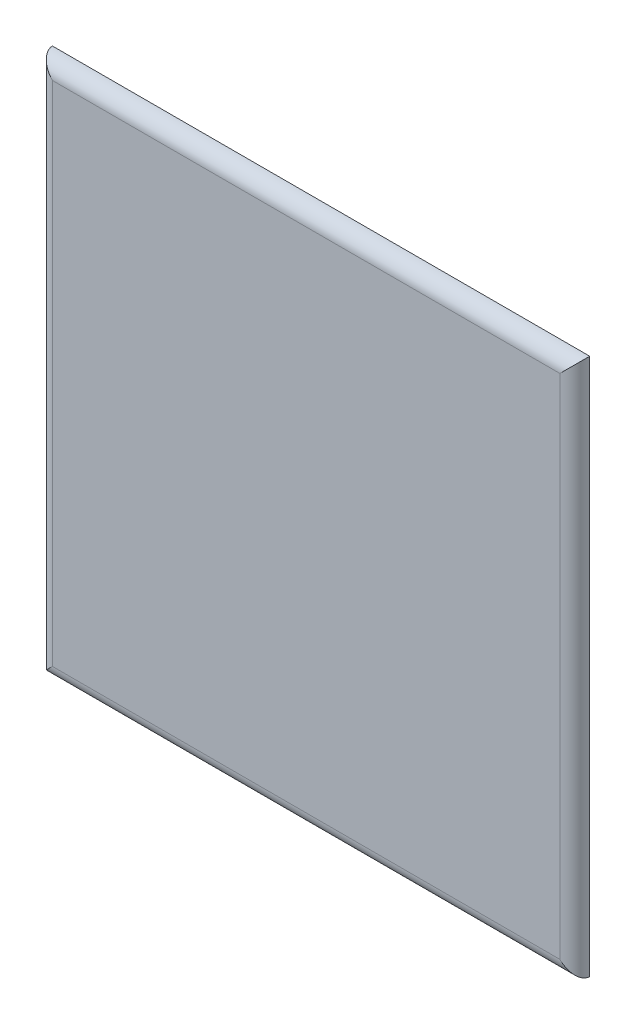
from build123d import *

# Parameters (mm, degrees)
IZIM1_W                     = 18
IZIM1_H                     = 18
Y_KSEKLIK_EKSTR_ZYON1_DEPTH = 0.25
RADYUS1_R                   = 0.5


with BuildPart() as part:
    # Çizim1 → Yükseklik-Ekstrüzyon1 (new, symmetric)
    with BuildSketch(Plane.XY):
        Rectangle(IZIM1_W, IZIM1_H)
    extrude(amount=Y_KSEKLIK_EKSTR_ZYON1_DEPTH, both=True)

    # Radyus1
    radyus1_edges = [part.edges().sort_by_distance(p)[0] for p in [
        (9, 0, 0.25),
        (0, -9, 0.25),
        (-9, 0, 0.25),
        (0, 9, 0.25),
    ]]
    fillet(radyus1_edges, radius=RADYUS1_R - 0.0001)  # a hair under: the kernel refuses the full size


solid = part.part
